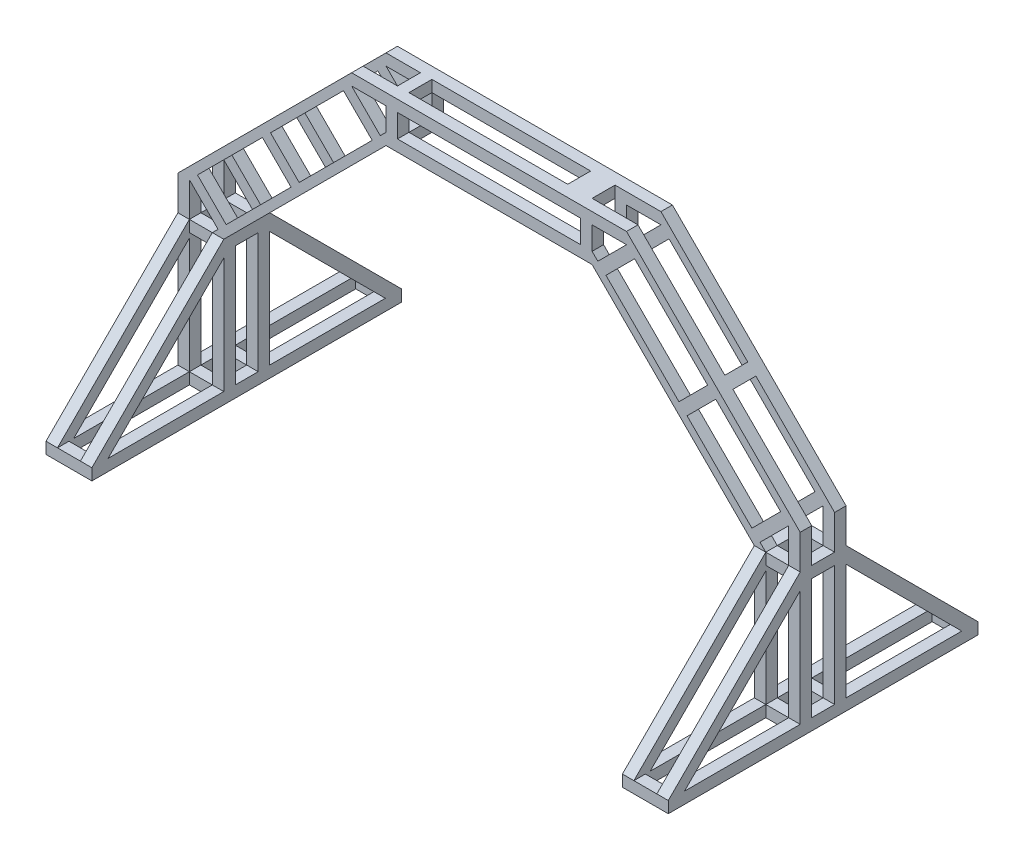
from build123d import *

# Parameters (mm, degrees)
SKETCH1_W             = 20
SKETCH1_H             = 310
BOSS_EXTRUDE1_DEPTH   = 20
SKETCH1_H_2           = 250
BOSS_EXTRUDE1_2_DEPTH = 20
BOSS_EXTRUDE1_3_DEPTH = 20
BOSS_EXTRUDE1_4_DEPTH = 20
BOSS_EXTRUDE2_DEPTH   = 20
SKETCH3_W             = 359.31457505
SKETCH3_H             = 20
SKETCH3_W_2           = 479.31457505
BOSS_EXTRUDE3_DEPTH   = 20
SKETCH4_W             = 40
SKETCH4_H             = 20
SKETCH4_W_2           = 20
SKETCH4_H_2           = 40
BOSS_EXTRUDE4_DEPTH   = 20
LPATTERN1_COUNT       = 2
LPATTERN1_PITCH       = 60
BOSS_EXTRUDE6_DEPTH   = 20
LPATTERN2_OUTLINE_W   = 20
LPATTERN2_OUTLINE_H   = 230
LPATTERN2_DEPTH       = 20
LPATTERN2_START       = -482.5
LPATTERN2_2_DEPTH     = 20
SKETCH5_W             = 20
SKETCH5_H             = 20
SKETCH5_W_2           = 42.5
SKETCH5_W_3           = 6.785714285
SKETCH5_H_2           = 6.785714285
BOSS_EXTRUDE5_DEPTH   = 40
MIRROR4_START         = -542.5
MIRROR4_DEPTH         = 20
MIRROR4_START_2       = -482.5
MIRROR4_2_DEPTH       = 20
MIRROR4_START_3       = 462.5
MIRROR4_3_DEPTH       = 20
MIRROR4_START_4       = 522.5
MIRROR4_4_DEPTH       = 20
MIRROR4_5_DEPTH       = 20
MIRROR4_6_DEPTH       = 20
SKETCH7_W             = 20
SKETCH7_H             = 20
BOSS_EXTRUDE7_DEPTH   = 40


# Read off the part's stored shape, not the designer's step: LPattern2, Mirror4
with BuildPart() as part:
    # Sketch1 → Boss-Extrude1 (new body)
    with BuildSketch(Plane.XY):
        with Locations((-532.5, 155)):
            Rectangle(SKETCH1_W, SKETCH1_H)
    extrude(amount=BOSS_EXTRUDE1_DEPTH)



with BuildPart() as body_2:
    # Sketch1 → Boss-Extrude1 2 (new body)
    with BuildSketch(Plane.XY):
        with Locations((-472.5, 125)):
            Rectangle(SKETCH1_W, SKETCH1_H_2)
    extrude(amount=BOSS_EXTRUDE1_2_DEPTH)


with BuildPart() as body_3:
    # Sketch1 → Boss-Extrude1 3 (new body)
    with BuildSketch(Plane.XY):
        with Locations((472.5, 125)):
            Rectangle(SKETCH1_W, SKETCH1_H_2)
    extrude(amount=BOSS_EXTRUDE1_3_DEPTH)


with BuildPart() as body_4:
    # Sketch1 → Boss-Extrude1 4 (new body)
    with BuildSketch(Plane.XY):
        with Locations((532.5, 155)):
            Rectangle(SKETCH1_W, SKETCH1_H)
    extrude(amount=BOSS_EXTRUDE1_4_DEPTH)


with BuildPart() as part_1:
    add(part.part)

    add(body_2.part)  # Boss-Extrude2 merges body 2
    # Sketch2 → Boss-Extrude2 (add)
    with BuildSketch(Plane.XY):
        Polygon((-542.5, 310), (-239.657287525, 612.842712475), (-239.657287525, 592.842712475), (-522.5, 310), align=None)
        Polygon((-482.5, 250), (-179.657287525, 552.842712475), (-179.657287525, 532.842712475), (-462.5, 250), align=None)
        Polygon((462.5, 250), (482.5, 250), (179.657287525, 552.842712475), (179.657287525, 532.842712475), align=None)
        Polygon((522.5, 310), (542.5, 310), (239.657287525, 612.842712475), (239.657287525, 592.842712475), align=None)
    extrude(amount=BOSS_EXTRUDE2_DEPTH)

    # Sketch3 → Boss-Extrude3 (add)
    with BuildSketch(Plane.XY):
        with Locations((0, 542.842712475)):
            Rectangle(SKETCH3_W, SKETCH3_H)
        with Locations((0, 602.842712475)):
            Rectangle(SKETCH3_W_2, SKETCH3_H)
    extrude(amount=BOSS_EXTRUDE3_DEPTH)


    add(body_3.part)  # Boss-Extrude4 merges body 3

    add(body_4.part)  # Boss-Extrude4 merges body 4
    # Sketch4 → Boss-Extrude4 (add)
    with BuildSketch(Plane.XY):
        with Locations((-502.5, 10)):
            Rectangle(SKETCH4_W, SKETCH4_H)
        with Locations((-169.657287525, 572.842712475)):
            Rectangle(SKETCH4_W_2, SKETCH4_H_2)
        Polygon((-395.220779386, 437.279220614), (-345.220779386, 387.279220614), (-331.078643763, 401.421356237), (-381.078643763, 451.421356237), align=None)
        with Locations((-502.5, 240)):
            Rectangle(SKETCH4_W, SKETCH4_H)
        Polygon((-472.5, 260), (-522.5, 310), (-508.357864376, 324.142135624), (-458.357864376, 274.142135624), align=None)
        Polygon((-239.657287525, 592.842712475), (-189.657287525, 542.842712475), (-203.799423149, 528.700576851), (-253.799423149, 578.700576851), align=None)
        Polygon((381.078643763, 451.421356237), (395.220779386, 437.279220614), (345.220779386, 387.279220614), (331.078643763, 401.421356237), align=None)
        Polygon((253.799423149, 578.700576851), (239.657287525, 592.842712475), (189.657287525, 542.842712475), (203.799423149, 528.700576851), align=None)
        Polygon((458.357864376, 274.142135624), (472.5, 260), (522.5, 310), (508.357864376, 324.142135624), align=None)
        with Locations((502.5, 240)):
            Rectangle(SKETCH4_W, SKETCH4_H)
        with Locations((169.657287525, 572.842712475)):
            Rectangle(SKETCH4_W_2, SKETCH4_H_2)
        with Locations((502.5, 10)):
            Rectangle(SKETCH4_W, SKETCH4_H)
    extrude(amount=BOSS_EXTRUDE4_DEPTH)


with BuildPart() as lpattern1_1:
    # LPattern1: pattern copy
    add(part_1.part.moved(Location(Vector(0, 0, -1) * (1 * LPATTERN1_PITCH))))

    # Mirror4 5 outline → Mirror4 5 (add)
    with BuildSketch(Plane.YZ.offset(MIRROR4_START_3)):
        Polygon((0, -60), (0, -290), (20, -290), (250, -60), (221.715728753, -60), (20, -261.715728753), (20, -60), align=None)
    extrude(amount=MIRROR4_5_DEPTH)

    # Mirror4 6 outline → Mirror4 6 (add)
    with BuildSketch(Plane.YZ.offset(MIRROR4_START_4)):
        Polygon((0, -60), (0, -290), (20, -290), (250, -60), (221.715728753, -60), (20, -261.715728753), (20, -60), align=None)
    extrude(amount=MIRROR4_6_DEPTH)



with BuildPart() as body_3_2:
    # Sketch6 → Boss-Extrude6 (new body)
    with BuildSketch(Plane.ZY.offset(542.5)):
        Polygon((-60, 250), (-290, 20), (-261.715728753, 20), (-60, 221.715728753), align=None)
        Polygon((-261.715728753, 20), (-290, 20), (-290, 0), (-60, 0), (-60, 20), align=None)
    extrude(amount=-BOSS_EXTRUDE6_DEPTH)


with BuildPart() as body_4_2:
    # LPattern2 outline → LPattern2 (new body)
    with BuildSketch(Plane(origin=(0, 0, 0), x_dir=(1, 0, 0), z_dir=(0, 1, 0))):
        with Locations((-472.5, 175)):
            Rectangle(LPATTERN2_OUTLINE_W, LPATTERN2_OUTLINE_H)
    extrude(amount=LPATTERN2_DEPTH)


with BuildPart() as body_5:
    # LPattern2 2 outline → LPattern2 2 (new body)
    with BuildSketch(Plane.YZ.offset(LPATTERN2_START)):
        Polygon((221.715728753, -60), (20, -261.715728753), (20, -290), (250, -60), align=None)
    extrude(amount=LPATTERN2_2_DEPTH)


with BuildPart() as part_2:
    add(part_1.part)

    # Sketch5 → Boss-Extrude5 (add)
    with BuildSketch(Plane.XY):
        with Locations((-532.5, 10)):
            Rectangle(SKETCH5_W, SKETCH5_H)
        with Locations((-472.5, 10)):
            Rectangle(SKETCH5_W, SKETCH5_H)
        with Locations((-472.5, 240)):
            Rectangle(SKETCH5_W, SKETCH5_H)
        with Locations((-532.5, 240)):
            Rectangle(SKETCH5_W, SKETCH5_H)
        with Locations((-169.657287525, 542.842712475)):
            Rectangle(SKETCH5_W, SKETCH5_H)
        with Locations((-169.657287525, 602.842712475)):
            Rectangle(SKETCH5_W, SKETCH5_H)
        with Locations((138.407287525, 602.842712475)):
            Rectangle(SKETCH5_W_2, SKETCH5_H)
        with Locations((156.264430382, 556.235569618)):
            Rectangle(SKETCH5_W_3, SKETCH5_H_2)
        with Locations((472.5, 240)):
            Rectangle(SKETCH5_W, SKETCH5_H)
        with Locations((532.5, 240)):
            Rectangle(SKETCH5_W, SKETCH5_H)
        Polygon((-381.078643763, 451.421356237), (-395.220779386, 437.279220614), (-405.220779386, 447.279220614), (-391.078643763, 461.421356237), align=None)
        with Locations((532.5, 10)):
            Rectangle(SKETCH5_W, SKETCH5_H)
        with Locations((472.5, 10)):
            Rectangle(SKETCH5_W, SKETCH5_H)
        Polygon((-345.220779386, 387.279220614), (-331.078643763, 401.421356237), (-321.078643763, 391.421356237), (-335.220779386, 377.279220614), align=None)
        Polygon((335.220779386, 377.279220614), (321.078643763, 391.421356237), (331.078643763, 401.421356237), (345.220779386, 387.279220614), align=None)
        Polygon((391.078643763, 461.421356237), (405.220779386, 447.279220614), (395.220779386, 437.279220614), (381.078643763, 451.421356237), align=None)
    extrude(amount=-BOSS_EXTRUDE5_DEPTH)


with BuildPart() as boss_extrude5_piece_1:
    # of the separate pieces the step leaves, piece 1, a body of its own (boss_extrude5_pieces)
    add(part_2.part.solids().sort_by_distance((462.5, 0, 20))[0])

    # Mirror4 outline → Mirror4 (add)
    with BuildSketch(Plane.YZ.offset(MIRROR4_START)):
        Polygon((0, 250), (0, 20), (20, 20), (20, 221.715728753), (221.715728753, 20), (250, 20), (20, 250), align=None)
    extrude(amount=MIRROR4_DEPTH)

    # Mirror4 2 outline → Mirror4 2 (add)
    with BuildSketch(Plane.YZ.offset(MIRROR4_START_2)):
        Polygon((0, 250), (0, 20), (20, 20), (20, 221.715728753), (221.715728753, 20), (250, 20), (20, 250), align=None)
    extrude(amount=MIRROR4_2_DEPTH)

    # Mirror4 3 outline → Mirror4 3 (add)
    with BuildSketch(Plane.YZ.offset(MIRROR4_START_3)):
        Polygon((0, 250), (0, 20), (20, 20), (20, 221.715728753), (221.715728753, 20), (250, 20), (20, 250), align=None)
    extrude(amount=MIRROR4_3_DEPTH)

    # Mirror4 4 outline → Mirror4 4 (add)
    with BuildSketch(Plane.YZ.offset(MIRROR4_START_4)):
        Polygon((0, 250), (0, 20), (20, 20), (20, 221.715728753), (221.715728753, 20), (250, 20), (20, 250), align=None)
    extrude(amount=MIRROR4_4_DEPTH)


with BuildPart() as boss_extrude5_piece_2:
    # of the separate pieces the step leaves, piece 2, a body of its own (boss_extrude5_pieces)
    add(part_2.part.solids().sort_by_distance((159.657287525, 559.62842676, -40))[0])


with BuildPart() as lpattern1_1_1:
    add(lpattern1_1.part)

    add(body_3_2.part)  # Boss-Extrude7 merges body 3 2

    add(body_4_2.part)  # Boss-Extrude7 merges body 4 2

    add(body_5.part)  # Boss-Extrude7 merges body 5

    add(boss_extrude5_piece_1.part)  # Boss-Extrude7 merges Boss-Extrude5 piece 1
    # Sketch7 → Boss-Extrude7 (add)
    with BuildSketch(Plane(origin=(-522.5, 0, 0), x_dir=(0, 0, -1), z_dir=(1, 0, 0))):
        with Locations((-240, 10)):
            Rectangle(SKETCH7_W, SKETCH7_H)
        with Locations((-10, 10)):
            Rectangle(SKETCH7_W, SKETCH7_H)
        with Locations((50, 10)):
            Rectangle(SKETCH7_W, SKETCH7_H)
        with Locations((280, 10)):
            Rectangle(SKETCH7_W, SKETCH7_H)
    boss_extrude7 = extrude(amount=BOSS_EXTRUDE7_DEPTH)

    # Mirror5: Boss-Extrude7 across plane
    add(boss_extrude7.mirror(Plane(origin=(0, 0, 0), x_dir=(0, 0, 1), z_dir=(1, 0, 0))))


solid = Compound([boss_extrude5_piece_2.part, lpattern1_1_1.part])
